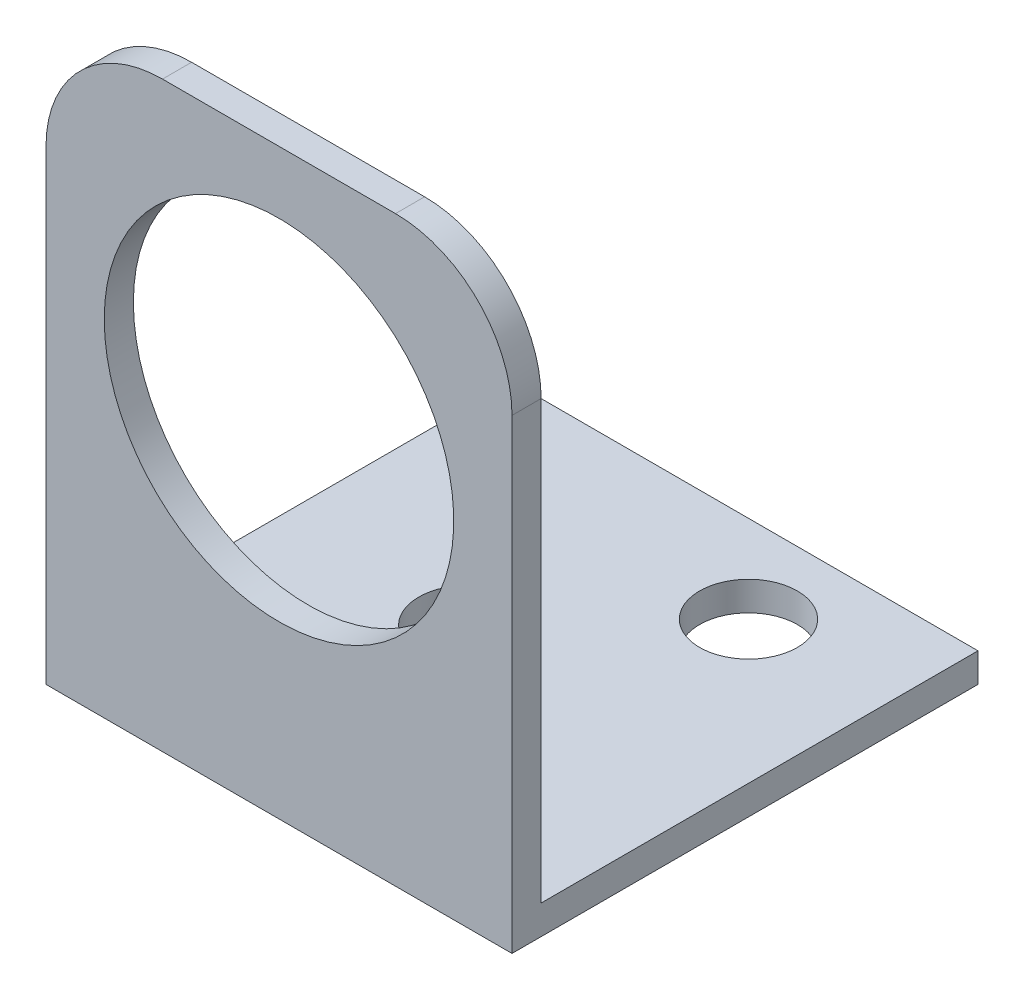
from build123d import *

# Parameters (mm, degrees)
BOSS_EXTRUDE1_DEPTH = 25.4
CUT_EXTRUDE1_REACH  = 49.12
SKETCH2_R           = 9.525
FILLET1_R           = 6.35
CUT_EXTRUDE2_REACH  = 49.941
SKETCH3_R           = 2.667


with BuildPart() as part:
    # Sketch1 → Boss-Extrude1 (new body)
    with BuildSketch(Plane(origin=(0, 0, 0), x_dir=(0, 0, -1), z_dir=(1, 0, 0))):
        Polygon((1.5875, 1.5875), (25.4, 1.5875), (25.4, 0), (0, 0), (0, 31.75), (1.5875, 31.75), align=None)
    extrude(amount=BOSS_EXTRUDE1_DEPTH)

    # Sketch2 → Cut-Extrude1 (cut, up to next)
    with BuildSketch(Plane(origin=(0, 0, -1.5875), x_dir=(-1, 0, 0), z_dir=(0, 0, -1)), mode=Mode.PRIVATE) as cut_extrude1_sk1:
        with Locations((-12.7, 18.830747356)):
            Circle(SKETCH2_R)
    cut_extrude1_tool1 = extrude(cut_extrude1_sk1.sketch, amount=-CUT_EXTRUDE1_REACH, mode=Mode.PRIVATE) & part.part
    add(cut_extrude1_tool1.solids().sort_by_distance((12.7, 18.830747, -1.5875))[0], mode=Mode.SUBTRACT)

    # Fillet1
    fillet1_edges = [part.edges().sort_by_distance(p)[0] for p in [
        (25.4, 31.75, -0.79375),
        (0, 31.75, -0.79375),
    ]]
    fillet(fillet1_edges, radius=FILLET1_R)

    # Sketch3 → Cut-Extrude2 (cut, up to next)
    with BuildSketch(Plane.XZ, mode=Mode.PRIVATE) as cut_extrude2_sk1:
        with Locations((17.653, -20.6375)):
            Circle(SKETCH3_R)
    cut_extrude2_tool1 = extrude(cut_extrude2_sk1.sketch, amount=-CUT_EXTRUDE2_REACH, mode=Mode.PRIVATE) & part.part
    # Sketch3 → Cut-Extrude2 (cut, up to next)
    with BuildSketch(Plane.XZ, mode=Mode.PRIVATE) as cut_extrude2_sk2:
        with Locations((10.287, -12.7)):
            Circle(SKETCH3_R)
    cut_extrude2_tool2 = extrude(cut_extrude2_sk2.sketch, amount=-CUT_EXTRUDE2_REACH, mode=Mode.PRIVATE) & part.part
    add(cut_extrude2_tool1.solids().sort_by_distance((17.653, 0, -20.6375))[0], mode=Mode.SUBTRACT)
    add(cut_extrude2_tool2.solids().sort_by_distance((10.287, 0, -12.7))[0], mode=Mode.SUBTRACT)


solid = part.part
